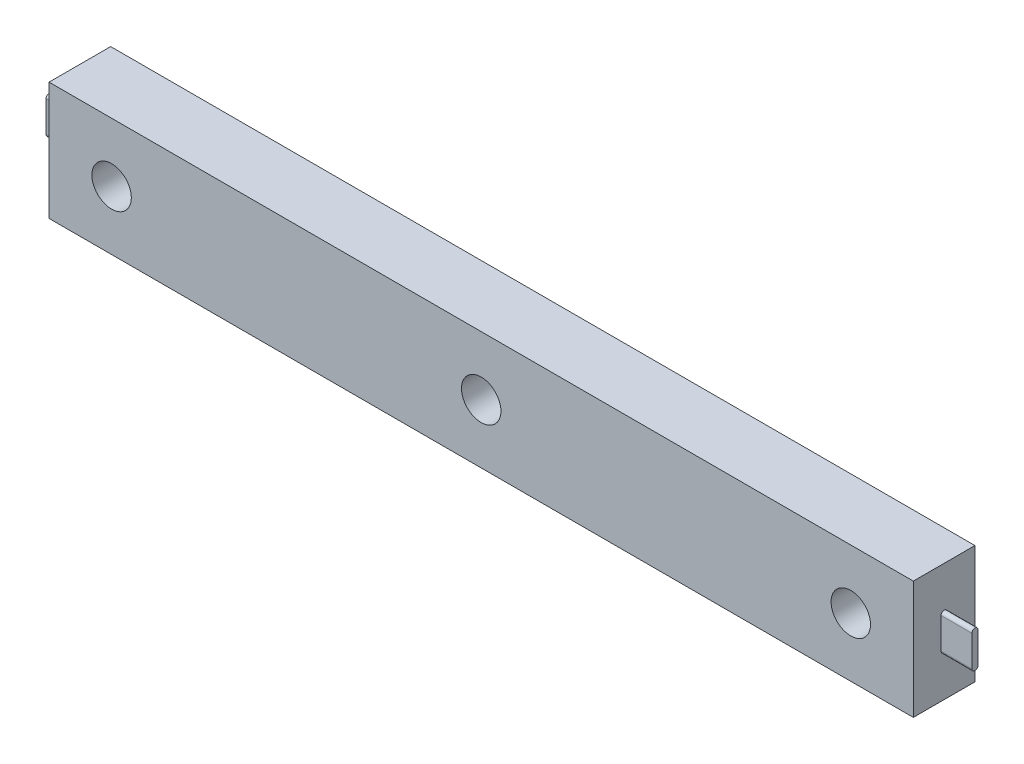
from build123d import *

# Parameters (mm, degrees)
SKETCH1_W           = 178.18598483
SKETCH1_H           = 24.345874344
SKETCH1_R           = 4.064
BOSS_EXTRUDE1_DEPTH = 12.7
BOSS_EXTRUDE2_DEPTH = 6.35
BOSS_EXTRUDE3_START = 6.35
BOSS_EXTRUDE3_DEPTH = 6.35


with BuildPart() as part:
    # Sketch1 → Boss-Extrude1 (new body)
    with BuildSketch(Plane.XY):
        Rectangle(SKETCH1_W, SKETCH1_H)
        Circle(SKETCH1_R, mode=Mode.SUBTRACT)
        with Locations((-76.2, 0)):
            Circle(SKETCH1_R, mode=Mode.SUBTRACT)
        with Locations((76.2, 0)):
            Circle(SKETCH1_R, mode=Mode.SUBTRACT)
    extrude(amount=BOSS_EXTRUDE1_DEPTH)

    # Sketch2 → Boss-Extrude2 (add)
    with BuildSketch(Plane.ZY.offset(89.092992415)):
        with BuildLine():
            Line((5.715, -3.175), (5.715, 3.175))
            ThreePointArc((5.715, 3.175), (6.35, 3.81), (6.985, 3.175))
            Line((6.985, 3.175), (6.985, -3.175))
            ThreePointArc((6.985, -3.175), (6.35, -3.81), (5.715, -3.175))
        make_face()
    extrude(amount=BOSS_EXTRUDE2_DEPTH)

    # Sketch3 → Boss-Extrude3 (add)
    with BuildSketch(Plane(origin=(89.092992415, 0, 0), x_dir=(0, 0, -1), z_dir=(1, 0, 0)).offset(BOSS_EXTRUDE3_START)):
        with BuildLine():
            Line((-5.715, 3.175), (-5.715, -3.175))
            ThreePointArc((-5.715, -3.175), (-6.35, -3.81), (-6.985, -3.175))
            Line((-6.985, -3.175), (-6.985, 3.175))
            ThreePointArc((-6.985, 3.175), (-6.35, 3.81), (-5.715, 3.175))
        make_face()
    extrude(amount=-BOSS_EXTRUDE3_DEPTH)


solid = part.part
